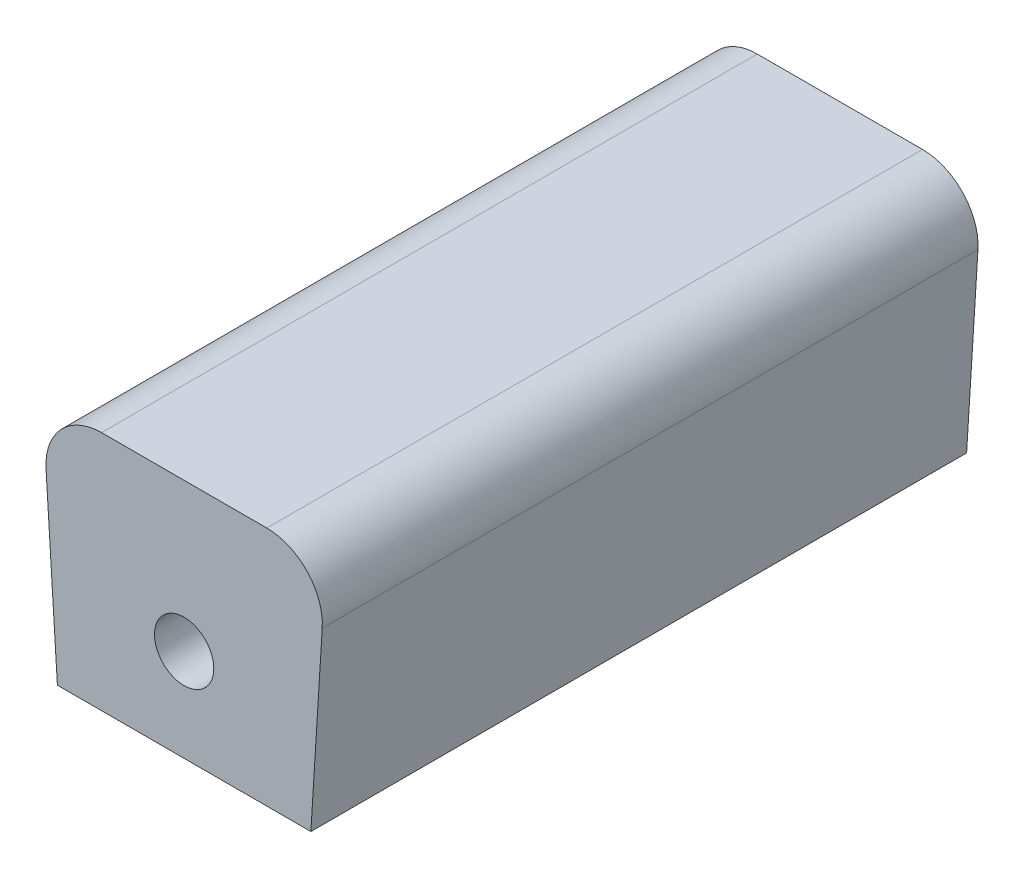
from build123d import *

# Parameters (mm, degrees)
SKETCH1_R           = 2.127
SKETCH1_R_2         = 2.032
BOSS_EXTRUDE1_DEPTH = 44.958
SKETCH2_W           = 61.162711876
SKETCH2_H           = 47.919892564
CUT_EXTRUDE1_DEPTH  = 57.200072865


with BuildPart() as part:
    # Sketch1 → Boss-Extrude1 (new body)
    with BuildSketch(Plane.XY):
        with BuildLine():
            Line((6.662551774, -21.675328207), (9.781210426, 28.223210221))
            ThreePointArc((9.781210426, 28.223210221), (8.75546188, 31.069569496), (5.978630102, 32.270871491))
            Line((5.978630102, 32.270871491), (-5.353526553, 32.270871491))
            ThreePointArc((-5.353526553, 32.270871491), (-8.130358331, 31.069569496), (-9.156106877, 28.223210221))
            Line((-9.156106877, 28.223210221), (-6.037448226, -21.675328207))
            ThreePointArc((-6.037448226, -21.675328207), (0.312551774, -27.895146648), (6.662551774, -21.675328207))
        make_face()
        with Locations((0.312551774, -22.815146648)):
            Circle(SKETCH1_R, mode=Mode.SUBTRACT)
        with Locations((0.312551774, 0.044853352)):
            Circle(SKETCH1_R, mode=Mode.SUBTRACT)
        with Locations((0.312551774, 22.110871491)):
            Circle(SKETCH1_R_2, mode=Mode.SUBTRACT)
    extrude(amount=BOSS_EXTRUDE1_DEPTH)

    # Sketch2 → Cut-Extrude1 (cut, through all)
    with BuildSketch(Plane.XY.offset(44.958)):
        with Locations((2.830749484, -8.199074791)):
            Rectangle(SKETCH2_W, SKETCH2_H)
    extrude(amount=-CUT_EXTRUDE1_DEPTH, mode=Mode.SUBTRACT)


solid = part.part
